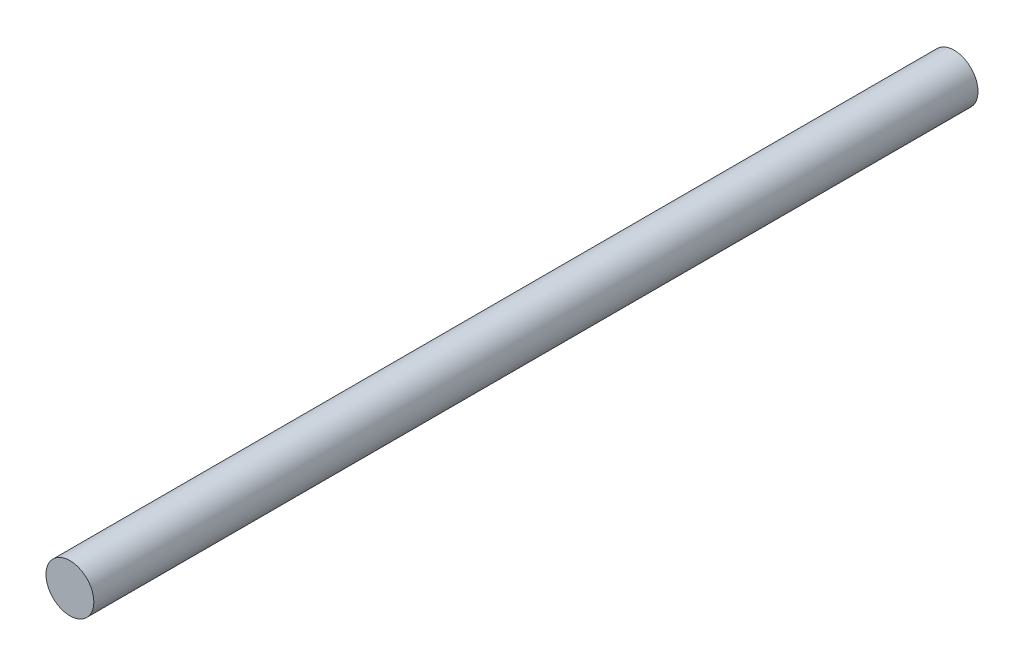
from build123d import *

# Parameters (mm, degrees)
BOSS_EXTRUDE1_OUTLINE_R = 6.35
BOSS_EXTRUDE1_DEPTH     = 234.74426


# Read off the part's stored shape, not the designer's step: Boss-Extrude1
with BuildPart() as part:
    # Boss-Extrude1 outline → Boss-Extrude1 (new body)
    with BuildSketch(Plane(origin=(0, 0, 211.88426), x_dir=(-1, 0, 0), z_dir=(0, 0, -1))):
        Circle(BOSS_EXTRUDE1_OUTLINE_R)
    extrude(amount=BOSS_EXTRUDE1_DEPTH)


solid = part.part
